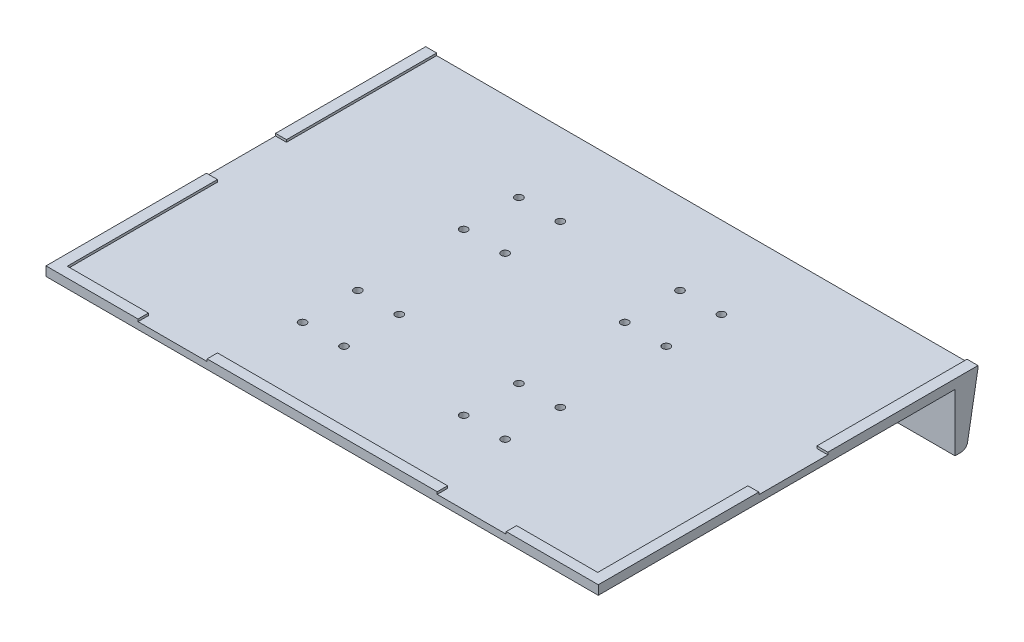
from build123d import *

# Parameters (mm, degrees)
BOSS_EXTRUDE3_DEPTH   = 4
SKETCH2_W             = 100
SKETCH2_H             = 4.5
BOSS_EXTRUDE3_2_DEPTH = 4
BOSS_EXTRUDE3_3_DEPTH = 4
SKETCH2_W_2           = 4.75
SKETCH2_H_2           = 65.25
BOSS_EXTRUDE3_4_DEPTH = 4
BOSS_EXTRUDE3_5_DEPTH = 4
SKETCH2_5_R           = 1.65
BOSS_EXTRUDE4_DEPTH   = 3
SKETCH3_W             = 240
SKETCH3_H             = 10
BOSS_EXTRUDE5_DEPTH   = 25
CUT_EXTRUDE1_DEPTH    = 256.012254607
FILLET2_R             = 3


with BuildPart() as part:
    # Sketch2 → Boss-Extrude3 (new body)
    with BuildSketch(Plane(origin=(0, 0, 0), x_dir=(1, 0, 0), z_dir=(0, 1, 0))):
        Polygon((115.25, -78), (80, -78), (80, -82.5), (120, -82.5), (120, -12.75), (115.25, -12.75), align=None)
    extrude(amount=BOSS_EXTRUDE3_DEPTH)



with BuildPart() as body_2:
    # Sketch2 → Boss-Extrude3 2 (new body)
    with BuildSketch(Plane(origin=(0, 0, 0), x_dir=(1, 0, 0), z_dir=(0, 1, 0))):
        with Locations((0, -80.25)):
            Rectangle(SKETCH2_W, SKETCH2_H)
    extrude(amount=BOSS_EXTRUDE3_2_DEPTH)


with BuildPart() as body_3:
    # Sketch2 → Boss-Extrude3 3 (new body)
    with BuildSketch(Plane(origin=(0, 0, 0), x_dir=(1, 0, 0), z_dir=(0, 1, 0))):
        Polygon((-80, -82.5), (-80, -78), (-115.25, -78), (-115.25, -12.75), (-120, -12.75), (-120, -82.5), align=None)
    extrude(amount=BOSS_EXTRUDE3_3_DEPTH)


with BuildPart() as body_4:
    # Sketch2 → Boss-Extrude3 4 (new body)
    with BuildSketch(Plane(origin=(0, 0, 0), x_dir=(1, 0, 0), z_dir=(0, 1, 0))):
        with Locations((117.625, 49.875)):
            Rectangle(SKETCH2_W_2, SKETCH2_H_2)
    extrude(amount=BOSS_EXTRUDE3_4_DEPTH)


with BuildPart() as body_5:
    # Sketch2 → Boss-Extrude3 5 (new body)
    with BuildSketch(Plane(origin=(0, 0, 0), x_dir=(1, 0, 0), z_dir=(0, 1, 0))):
        with Locations((-117.625, 49.875)):
            Rectangle(SKETCH2_W_2, SKETCH2_H_2)
    extrude(amount=BOSS_EXTRUDE3_5_DEPTH)


with BuildPart() as part_1:
    add(part.part)

    add(body_2.part)  # Boss-Extrude4 merges body 2

    add(body_3.part)  # Boss-Extrude4 merges body 3

    add(body_4.part)  # Boss-Extrude4 merges body 4

    add(body_5.part)  # Boss-Extrude4 merges body 5
    # Sketch2<5> → Boss-Extrude4 (add)
    with BuildSketch(Plane(origin=(0, 0, 0), x_dir=(1, 0, 0), z_dir=(0, 1, 0))):
        Polygon((80, -82.5), (80, -78), (115.25, -78), (115.25, -12.75), (120, -12.75), (120, 17.25), (115.25, 17.25), (115.25, 82.5), (-115.25, 82.5), (-115.25, 17.25), (-120, 17.25), (-120, -12.75), (-115.25, -12.75), (-115.25, -78), (-80, -78), (-80, -82.5), (-50, -82.5), (-50, -78), (50, -78), (50, -82.5), align=None)
        with Locations((44, 47)):
            Circle(SKETCH2_5_R, mode=Mode.SUBTRACT)
        with Locations((-44, -47)):
            Circle(SKETCH2_5_R, mode=Mode.SUBTRACT)
        with Locations((-26, -47)):
            Circle(SKETCH2_5_R, mode=Mode.SUBTRACT)
        with Locations((-44, -23)):
            Circle(SKETCH2_5_R, mode=Mode.SUBTRACT)
        with Locations((-26, -23)):
            Circle(SKETCH2_5_R, mode=Mode.SUBTRACT)
        with Locations((26, -47)):
            Circle(SKETCH2_5_R, mode=Mode.SUBTRACT)
        with Locations((44, -47)):
            Circle(SKETCH2_5_R, mode=Mode.SUBTRACT)
        with Locations((26, -23)):
            Circle(SKETCH2_5_R, mode=Mode.SUBTRACT)
        with Locations((44, -23)):
            Circle(SKETCH2_5_R, mode=Mode.SUBTRACT)
        with Locations((-44, 23)):
            Circle(SKETCH2_5_R, mode=Mode.SUBTRACT)
        with Locations((-26, 23)):
            Circle(SKETCH2_5_R, mode=Mode.SUBTRACT)
        with Locations((-44, 47)):
            Circle(SKETCH2_5_R, mode=Mode.SUBTRACT)
        with Locations((-26, 47)):
            Circle(SKETCH2_5_R, mode=Mode.SUBTRACT)
        with Locations((26, 23)):
            Circle(SKETCH2_5_R, mode=Mode.SUBTRACT)
        with Locations((44, 23)):
            Circle(SKETCH2_5_R, mode=Mode.SUBTRACT)
        with Locations((26, 47)):
            Circle(SKETCH2_5_R, mode=Mode.SUBTRACT)
    extrude(amount=BOSS_EXTRUDE4_DEPTH)

    # Sketch3 → Boss-Extrude5 (add)
    with BuildSketch(Plane.XZ):
        with Locations((0, -77.5)):
            Rectangle(SKETCH3_W, SKETCH3_H)
    extrude(amount=BOSS_EXTRUDE5_DEPTH)

    # Sketch4 → Cut-Extrude1 (cut, through all)
    with BuildSketch(Plane(origin=(120, 0, 0), x_dir=(0, 0, -1), z_dir=(1, 0, 0))):
        Polygon((82.5, 3), (77.56284454, -25), (82.5, -25), align=None)
    extrude(amount=-CUT_EXTRUDE1_DEPTH, mode=Mode.SUBTRACT)

    # Fillet2
    fillet2_edges = [part_1.edges().sort_by_distance(p)[0] for p in [
        (0, -25, -77.56284454),
    ]]
    fillet(fillet2_edges, radius=FILLET2_R)


solid = part_1.part
